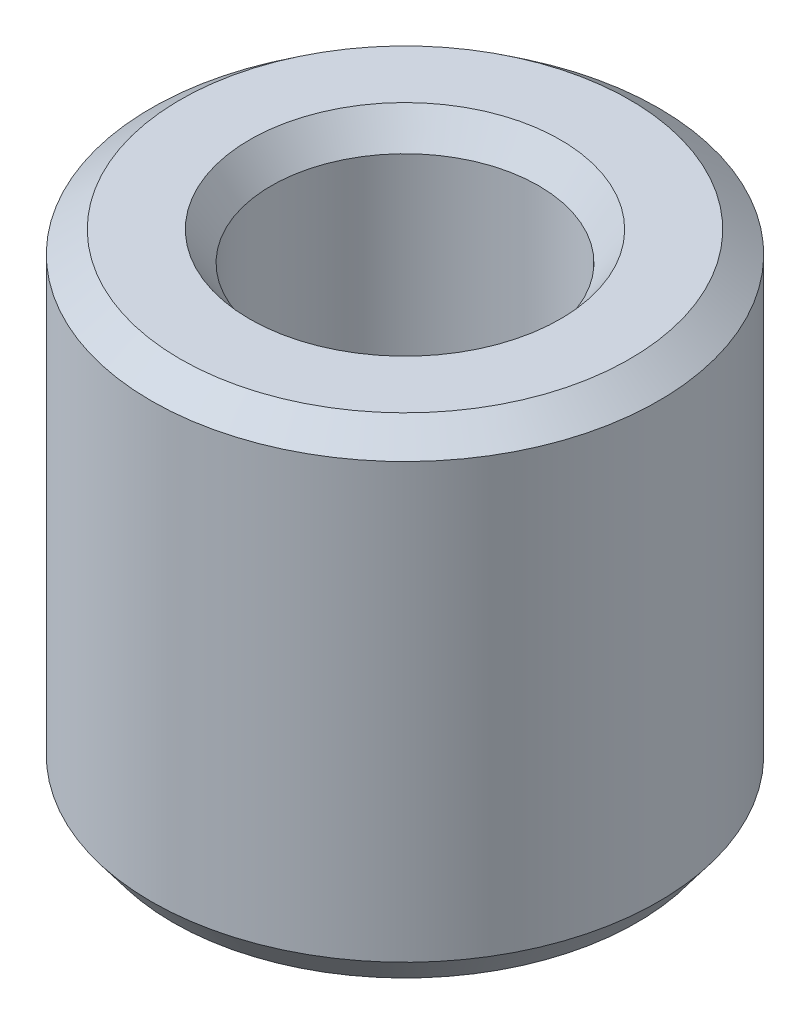
from build123d import *
from OCP.BRepFilletAPI import BRepFilletAPI_MakeChamfer

# Parameters (mm, degrees)
SKETCH1_R           = 30
BOSS_EXTRUDE1_DEPTH = 57.284058692
SKETCH2_R           = 15.80590176
CUT_EXTRUDE1_DEPTH  = 72.284383846
CHAMFER1_SIZE       = 2.567620947
CHAMFER1_SIZE2      = 3.425239708


with BuildPart() as part:
    # Sketch1 → Boss-Extrude1 (new body)
    with BuildSketch(Plane(origin=(0, 0, 0), x_dir=(1, 0, 0), z_dir=(0, 1, 0))):
        Circle(SKETCH1_R)
    extrude(amount=BOSS_EXTRUDE1_DEPTH)

    # Sketch2 → Cut-Extrude1 (cut, through all)
    with BuildSketch(Plane(origin=(0, 0, 0), x_dir=(1, 0, 0), z_dir=(0, 1, 0))):
        Circle(SKETCH2_R)
    extrude(amount=CUT_EXTRUDE1_DEPTH, mode=Mode.SUBTRACT)

    # Chamfer1: one chamfer whose edges measure the first distance from different faces: ONE call of the kernel's chamfer builder (chamfer() names one face for all edges)
    chamfer1_edges_1 = [part.edges().sort_by_distance(p)[0] for p in [
        (-15.80590176, 57.284058692, 0),
    ]]
    chamfer1_side_1 = [part.faces().sort_by_distance(p)[0] for p in [
        (-29.151471863, 57.284058692, 0),
    ]]
    chamfer1_edges_2 = [part.edges().sort_by_distance(p)[0] for p in [
        (-15.80590176, 0, 0),
    ]]
    chamfer1_side_2 = [part.faces().sort_by_distance(p)[0] for p in [
        (-15.80590176, 28.642029346, 0),
    ]]
    chamfer1_edges_3 = [part.edges().sort_by_distance(p)[0] for p in [
        (-30, 0, 0),
    ]]
    chamfer1_side_3 = [part.faces().sort_by_distance(p)[0] for p in [
        (-29.151471863, 0, 0),
    ]]
    chamfer1_edges_4 = [part.edges().sort_by_distance(p)[0] for p in [
        (-30, 57.284058692, 0),
    ]]
    chamfer1_side_4 = [part.faces().sort_by_distance(p)[0] for p in [
        (-30, 28.642029346, 0),
    ]]
    chamfer1 = BRepFilletAPI_MakeChamfer(part.part.solid().wrapped)
    for e in chamfer1_edges_1:
        chamfer1.Add(CHAMFER1_SIZE, CHAMFER1_SIZE2, e.wrapped, chamfer1_side_1[0].wrapped)  # the first distance lies on this face
    for e in chamfer1_edges_2:
        chamfer1.Add(CHAMFER1_SIZE, CHAMFER1_SIZE2, e.wrapped, chamfer1_side_2[0].wrapped)  # the first distance lies on this face
    for e in chamfer1_edges_3:
        chamfer1.Add(CHAMFER1_SIZE, CHAMFER1_SIZE2, e.wrapped, chamfer1_side_3[0].wrapped)  # the first distance lies on this face
    for e in chamfer1_edges_4:
        chamfer1.Add(CHAMFER1_SIZE, CHAMFER1_SIZE2, e.wrapped, chamfer1_side_4[0].wrapped)  # the first distance lies on this face
    add(Compound.cast(chamfer1.Shape()), mode=Mode.REPLACE)


solid = part.part
